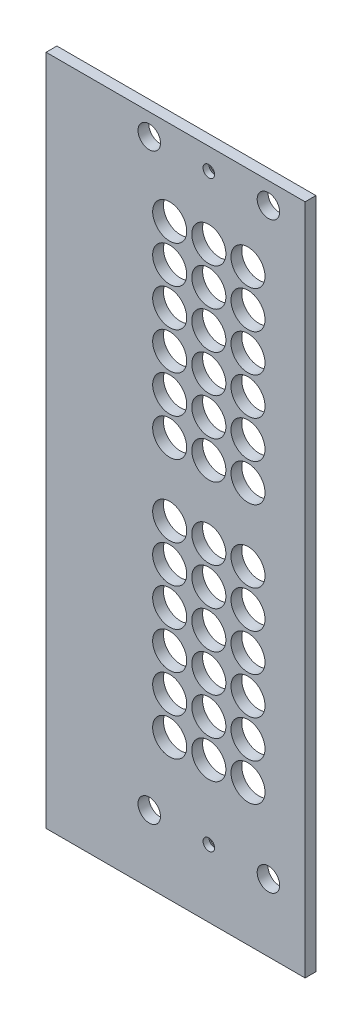
from build123d import *

# Parameters (mm, degrees)
SKETCH1_W                                       = 56.55
SKETCH1_H                                       = 197.425
BOSS_EXTRUDE1_DEPTH                             = 3.175
SKETCH2_R                                       = 5
CUT_EXTRUDE1_DEPTH                              = 10
LPATTERN1_COUNT                                 = 6
LPATTERN1_PITCH                                 = 11
SKETCH5_W                                       = 3.175
SKETCH5_H                                       = 197.425
BOSS_EXTRUDE2_DEPTH                             = 19.525
M6_CLEARANCE_HOLE1_D                            = 6.6
CSK_FOR_M3_FLAT_HEAD_MACHINE_SCREW2_D           = 3.4
CSK_FOR_M3_FLAT_HEAD_MACHINE_SCREW2_CSINK_D     = 6.3
CSK_FOR_M3_FLAT_HEAD_MACHINE_SCREW2_CSINK_ANGLE = 90


with BuildPart() as part:
    # Sketch1 → Boss-Extrude1 (new body)
    with BuildSketch(Plane.XY):
        Rectangle(SKETCH1_W, SKETCH1_H)
    extrude(amount=BOSS_EXTRUDE1_DEPTH)

    # Sketch2 → Cut-Extrude1 (cut)
    with BuildSketch(Plane(origin=(0, 0, 0), x_dir=(-1, 0, 0), z_dir=(0, 0, -1))):
        with Locations((11.5, -57.369162839)):
            Circle(SKETCH2_R)
        with Locations((-11.5, -57.369162839)):
            Circle(SKETCH2_R)
        with Locations((0, -57.369162839)):
            Circle(SKETCH2_R)
        with Locations((0, 18.830837161)):
            Circle(SKETCH2_R)
        with Locations((-11.5, 18.830837161)):
            Circle(SKETCH2_R)
        with Locations((11.5, 18.830837161)):
            Circle(SKETCH2_R)
    cut_extrude1 = extrude(amount=-CUT_EXTRUDE1_DEPTH, mode=Mode.SUBTRACT)

    # LPattern1: Cut-Extrude1 ×6
    with Locations(*[(0, i * LPATTERN1_PITCH, 0) for i in range(1, LPATTERN1_COUNT)]):
        add(cut_extrude1, mode=Mode.SUBTRACT)

    # Sketch5 → Boss-Extrude2 (add)
    with BuildSketch(Plane.ZY.offset(28.275)):
        with Locations((1.5875, 0)):
            Rectangle(SKETCH5_W, SKETCH5_H)
    extrude(amount=BOSS_EXTRUDE2_DEPTH)

    # M6 Clearance Hole1 (through all)
    with Locations(Plane.XY.offset(3.175)):
        with Locations((-17.5, -78.8875), (17.5, -78.8875), (-17.5, 92.3625), (17.5, 92.3625)):
            Hole(M6_CLEARANCE_HOLE1_D / 2)

    # CSK for M3 Flat Head Machine Screw2 (through all)
    with Locations(Plane(origin=(0, 0, 0), x_dir=(-1, 0, 0), z_dir=(0, 0, -1))):
        with Locations((0, -78.8875), (0, 92.3625)):
            CounterSinkHole(CSK_FOR_M3_FLAT_HEAD_MACHINE_SCREW2_D / 2, CSK_FOR_M3_FLAT_HEAD_MACHINE_SCREW2_CSINK_D / 2, counter_sink_angle=CSK_FOR_M3_FLAT_HEAD_MACHINE_SCREW2_CSINK_ANGLE)


solid = part.part
